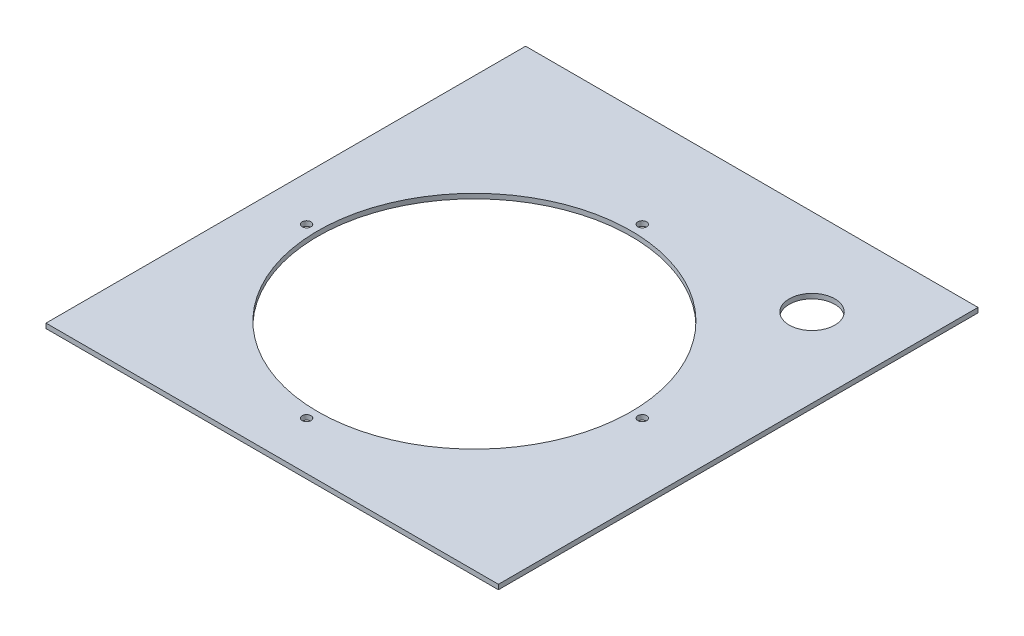
from build123d import *

# Parameters (mm, degrees)
SKETCH1_W           = 300
SKETCH1_H           = 330
BOSS_EXTRUDE1_DEPTH = 3
CUT_EXTRUDE1_REACH  = 447.992
SKETCH2_R           = 98
SKETCH2_R_2         = 14.255
SKETCH4_R           = 2.75
CUT_EXTRUDE3_DEPTH  = 446.992152397
SKETCH6_W           = 300
SKETCH6_H           = 30
CUT_EXTRUDE5_DEPTH  = 446.992152397
SKETCH7_W           = 17
SKETCH7_H           = 300
CUT_EXTRUDE6_DEPTH  = 425.274675181


with BuildPart() as part:
    # Sketch1 → Boss-Extrude1 (new body)
    with BuildSketch(Plane(origin=(0, 0, 0), x_dir=(1, 0, 0), z_dir=(0, 1, 0))):
        with Locations((150, -165)):
            Rectangle(SKETCH1_W, SKETCH1_H)
    extrude(amount=BOSS_EXTRUDE1_DEPTH)

    # Sketch2 → Cut-Extrude1 (cut, up to next)
    with BuildSketch(Plane(origin=(0, 3, 0), x_dir=(1, 0, 0), z_dir=(0, 1, 0)), mode=Mode.PRIVATE) as cut_extrude1_sk1:
        with Locations((150, -165)):
            Circle(SKETCH2_R)
    cut_extrude1_tool1 = extrude(cut_extrude1_sk1.sketch, amount=-CUT_EXTRUDE1_REACH, mode=Mode.PRIVATE) & part.part
    # Sketch2 → Cut-Extrude1 (cut, up to next)
    with BuildSketch(Plane(origin=(0, 3, 0), x_dir=(1, 0, 0), z_dir=(0, 1, 0)), mode=Mode.PRIVATE) as cut_extrude1_sk2:
        with Locations((250.564582702, -54.378959027)):
            Circle(SKETCH2_R_2)
    cut_extrude1_tool2 = extrude(cut_extrude1_sk2.sketch, amount=-CUT_EXTRUDE1_REACH, mode=Mode.PRIVATE) & part.part
    add(cut_extrude1_tool1.solids().sort_by_distance((150, 3, 165))[0], mode=Mode.SUBTRACT)
    add(cut_extrude1_tool2.solids().sort_by_distance((250.564583, 3, 54.378959))[0], mode=Mode.SUBTRACT)

    # Sketch4 → Cut-Extrude3 (cut, through all)
    with BuildSketch(Plane(origin=(0, 3, 0), x_dir=(1, 0, 0), z_dir=(0, 1, 0))):
        with Locations((45, -165)):
            Circle(SKETCH4_R)
        with Locations((255, -165)):
            Circle(SKETCH4_R)
        with Locations((150, -270)):
            Circle(SKETCH4_R)
        with Locations((150, -60)):
            Circle(SKETCH4_R)
    extrude(amount=-CUT_EXTRUDE3_DEPTH, mode=Mode.SUBTRACT)

    # Sketch6 → Cut-Extrude5 (cut, through all)
    with BuildSketch(Plane(origin=(0, 3, 0), x_dir=(1, 0, 0), z_dir=(0, 1, 0))):
        with Locations((150, -315)):
            Rectangle(SKETCH6_W, SKETCH6_H)
    extrude(amount=-CUT_EXTRUDE5_DEPTH, mode=Mode.SUBTRACT)

    # Sketch7 → Cut-Extrude6 (cut, through all)
    with BuildSketch(Plane(origin=(0, 3, 0), x_dir=(1, 0, 0), z_dir=(0, 1, 0))):
        with Locations((8.5, -150)):
            Rectangle(SKETCH7_W, SKETCH7_H)
    extrude(amount=-CUT_EXTRUDE6_DEPTH, mode=Mode.SUBTRACT)


solid = part.part
